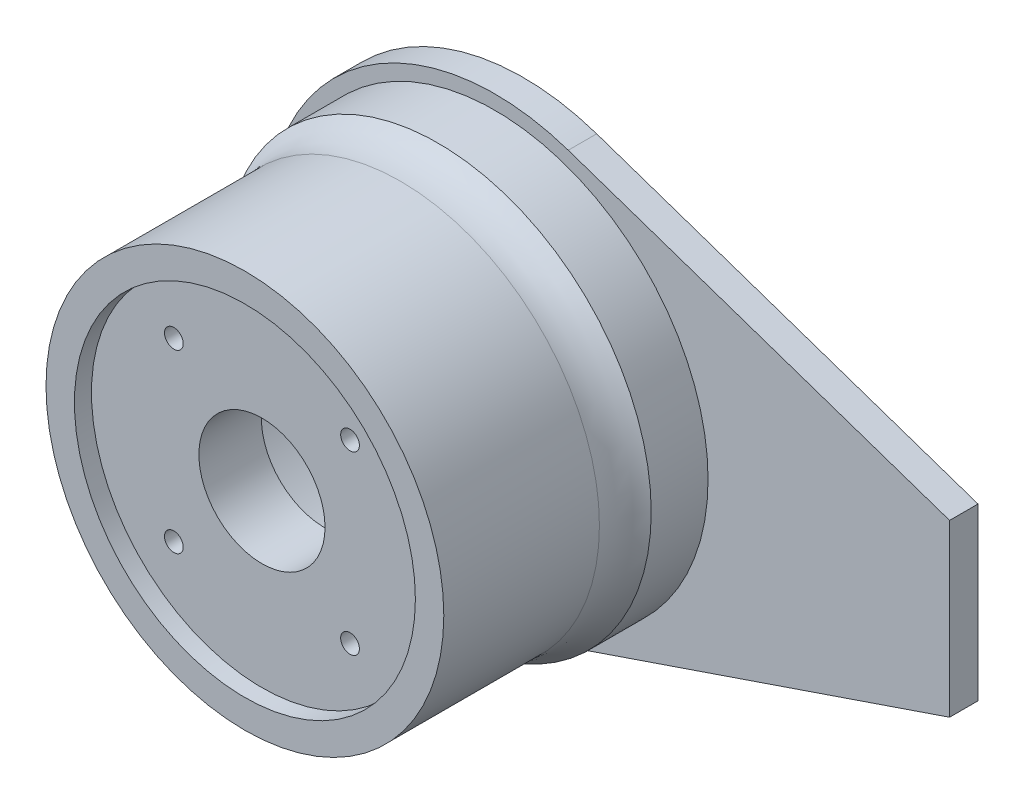
from build123d import *

# Parameters (mm, degrees)
ESQUISSE1_R             = 35
ESQUISSE1_R_2           = 11.1
ESQUISSE1_R_3           = 1.65
BOSS_EXTRU_1_DEPTH      = 14
BOSS_EXTRU_5_START      = 20
ESQUISSE2_R             = 35
ESQUISSE2_R_2           = 29.905514519
BOSS_EXTRU_5_DEPTH      = 20
BOSS_EXTRU_6_START      = 10
ESQUISSE5_R             = 37.5
ESQUISSE5_R_2           = 29.905514519
BOSS_EXTRU_6_DEPTH      = 10
CONG_1_R                = 10
BOSS_EXTRU_7_START      = 5
ESQUISSE6_R             = 29.905514519
BOSS_EXTRU_7_DEPTH      = 5
ESQUISSE7_R             = 30
ENL_V_MAT_EXTRU_1_DEPTH = 3


with BuildPart() as part:
    # Esquisse1 → Boss.-Extru.1 (new body)
    with BuildSketch(Plane.XY):
        Circle(ESQUISSE1_R)
        Circle(ESQUISSE1_R_2, mode=Mode.SUBTRACT)
        with Locations((-15.5, 15.5)):
            Circle(ESQUISSE1_R_3, mode=Mode.SUBTRACT)
        with Locations((15.5, 15.5)):
            Circle(ESQUISSE1_R_3, mode=Mode.SUBTRACT)
        with Locations((15.5, -15.5)):
            Circle(ESQUISSE1_R_3, mode=Mode.SUBTRACT)
        with Locations((-15.5, -15.5)):
            Circle(ESQUISSE1_R_3, mode=Mode.SUBTRACT)
    extrude(amount=BOSS_EXTRU_1_DEPTH)

    # Esquisse2 → Boss.-Extru.5 (add)
    with BuildSketch(Plane(origin=(0, 0, 0), x_dir=(-1, 0, 0), z_dir=(0, 0, -1)).offset(BOSS_EXTRU_5_START)):
        Circle(ESQUISSE2_R)
        Circle(ESQUISSE2_R_2, mode=Mode.SUBTRACT)
    extrude(amount=-BOSS_EXTRU_5_DEPTH)

    # Esquisse5 → Boss.-Extru.6 (add)
    with BuildSketch(Plane(origin=(0, 0, -20), x_dir=(-1, 0, 0), z_dir=(0, 0, -1)).offset(BOSS_EXTRU_6_START)):
        Circle(ESQUISSE5_R)
        Circle(ESQUISSE5_R_2, mode=Mode.SUBTRACT)
    extrude(amount=-BOSS_EXTRU_6_DEPTH)

    # Congé1
    # the kernel refuses this fillet: 10 mm, written as the material it adds along each edge
    with BuildSketch(Plane(origin=(0, 0, -20), x_dir=(-1, 0, 0), z_dir=(0, -1, 0))) as cong_1_piece_1:
        with BuildLine():
            CenterArc((45, -6.614378278), CONG_1_R, 138.590377891, 41.409622109)
            Line((37.5, 0), (37.35, 0.132287566))
            ThreePointArc((37.35, 0.132287566), (36.25, 0.2), (35, 0.2))
            Line((35, 0.2), (34.8, 0))
            Line((34.8, 0), (34.8, -6.614378278))
            Line((34.8, -6.614378278), (35, -6.614378278))
        make_face()
    revolve(axis=Axis((0, 0, -20), (0, 0, -1)))

    # Esquisse6 → Boss.-Extru.7 (add)
    with BuildSketch(Plane(origin=(0, 0, -30), x_dir=(-1, 0, 0), z_dir=(0, 0, -1)).offset(BOSS_EXTRU_7_START)):
        with BuildLine():
            Line((-12.900778772, 37.862513217), (-80, 15))
            Line((-80, 15), (-80, -15))
            Line((-80, -15), (-12.900778772, -37.862513217))
            ThreePointArc((-12.900778772, -37.862513217), (40, 0), (-12.900778772, 37.862513217))
        make_face()
        Circle(ESQUISSE6_R, mode=Mode.SUBTRACT)
    extrude(amount=-BOSS_EXTRU_7_DEPTH)

    # Esquisse7 → Enlèv. mat.-Extru.1 (cut)
    with BuildSketch(Plane.XY.offset(14)):
        Circle(ESQUISSE7_R)
    extrude(amount=-ENL_V_MAT_EXTRU_1_DEPTH, mode=Mode.SUBTRACT)


solid = part.part
